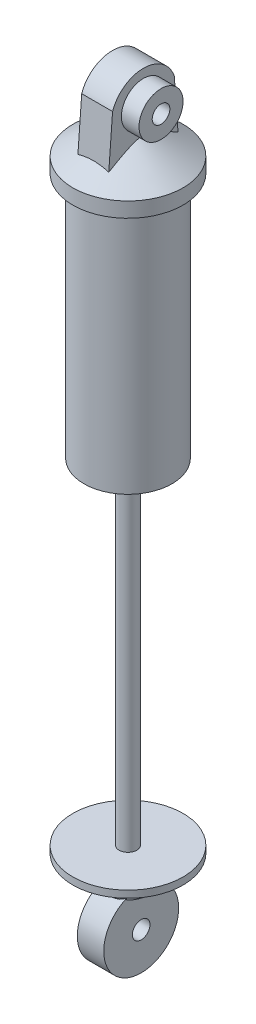
from build123d import *

# Parameters (mm, degrees)
SKETCH1_R          = 7.9375
EXTRUDE1_DEPTH     = 86.995
SKETCH4_R          = 1.27
EXTRUDE2_DEPTH     = 2.2225
SKETCH5_R          = 5.3975
SKETCH5_R_2        = 1.27
EXTRUDE3_DEPTH     = 1.905
SKETCH6_R          = 4.1275
EXTRUDE4_DEPTH     = 1.905
SKETCH7_R          = 2.8575
EXTRUDE5_DEPTH     = 1.905
SKETCH8_R          = 3.175
SKETCH8_R_2        = 1.27
EXTRUDE6_DEPTH     = 2.54
SKETCH10_R         = 7.9375
SKETCH10_R_2       = 6.35
CUT_EXTRUDE2_DEPTH = 38.1
SKETCH11_R         = 7.9375
SKETCH11_R_2       = 1.27
CUT_EXTRUDE3_DEPTH = 48.26


with BuildPart() as part:
    # Sketch1 → Extrude1 (new body)
    with BuildSketch(Plane(origin=(0, 0, 0), x_dir=(1, 0, 0), z_dir=(0, 1, 0))):
        with Locations(Location((0, 0, 0), (0, 0, 270))):
            Circle(SKETCH1_R)
    extrude(amount=-EXTRUDE1_DEPTH)

    # Loft1: read off the stored shape, not the designer's step
    # Loft1: loft between two sections, ruled curve by curve
    loft1_from = [
        Edge.make_bspline([(3.207196431, 0, 7.26070226), (17.72860095, 0, 0.846309398), (11.314208088, 0, -13.675095122), (-3.207196431, 0, -7.26070226), (-17.72860095, 0, -0.846309398), (-11.314208088, 0, 13.675095122), (3.207196431, 0, 7.26070226)], [0, 0, 0, 0, 0.5, 0.5, 0.5, 1, 1, 1, 1], 3, [1, 0.333333333, 0.333333333, 1, 0.333333333, 0.333333333, 1]),
    ]
    loft1_to = [
        Edge.make_bspline([(0.075387957, 3.937, 1.903507724), (3.882403406, 3.937, 1.75273181), (3.731627491, 3.937, -2.054283639), (-0.075387957, 3.937, -1.903507724), (-3.882403406, 3.937, -1.75273181), (-3.731627491, 3.937, 2.054283639), (0.075387957, 3.937, 1.903507724)], [0, 0, 0, 0, 0.5, 0.5, 0.5, 1, 1, 1, 1], 3, [1, 0.333333333, 0.333333333, 1, 0.333333333, 0.333333333, 1]),
    ]
    loft1 = Solid(Shell([*[Face.make_surface_from_curves(loft1_from[k], loft1_to[k]) for k in range(1)], Face(Wire(loft1_from)), Face(Wire(loft1_to))]))
    add(loft1)

    # Sketch4 → Extrude2 (add, symmetric)
    with BuildSketch(Plane(origin=(0, 0, 0), x_dir=(0, 0, -1), z_dir=(1, 0, 0))):
        with BuildLine():
            Line((4.965601833, 1.905), (4.445, 8.89))
            ThreePointArc((4.445, 8.89), (0, 12.065), (-4.445, 8.89))
            Line((-4.445, 8.89), (-4.965601949, 1.905))
            Line((-4.965601949, 1.905), (-5.107584298, 0))
            Line((-5.107584298, 0), (5.107584151, 0))
            Line((5.107584151, 0), (4.965601833, 1.905))
        make_face()
        with Locations((0, 7.62)):
            Circle(SKETCH4_R, mode=Mode.SUBTRACT)
    extrude(amount=EXTRUDE2_DEPTH, both=True)

    # Sketch6 → Extrude4 (add)
    with BuildSketch(Plane.XZ.offset(86.995)):
        with Locations(Location((0, 0, 0), (0, 0, 90))):
            Circle(SKETCH6_R)
    extrude(amount=EXTRUDE4_DEPTH)



with BuildPart() as body_2:
    # Sketch5 → Extrude3 (new, symmetric)
    with BuildSketch(Plane(origin=(0, 0, 0), x_dir=(0, 0, -1), z_dir=(1, 0, 0))):
        with Locations(Location((0, -95.5675, 0), (0, 0, 180))):
            Circle(SKETCH5_R)
        with Locations(Location((0, -95.5675, 0), (0, 0, 180))):
            Circle(SKETCH5_R_2, mode=Mode.SUBTRACT)
    extrude(amount=EXTRUDE3_DEPTH, both=True)


with BuildPart() as part_1:
    add(part.part)

    add(body_2.part)  # Extrude5 merges body 2
    # Sketch7 → Extrude5 (add)
    with BuildSketch(Plane.XZ.offset(88.9)):
        with Locations(Location((0, 0, 0), (0, 0, 117.266044451))):
            Circle(SKETCH7_R)
    extrude(amount=EXTRUDE5_DEPTH)

    # Sketch8 → Extrude6 (add)
    with BuildSketch(Plane(origin=(2.2225, 0, 0), x_dir=(0, 0, -1), z_dir=(1, 0, 0))):
        with Locations(Location((0, 7.62, 0), (0, 0, 180))):
            Circle(SKETCH8_R)
        with Locations((0, 7.62)):
            Circle(SKETCH8_R_2, mode=Mode.SUBTRACT)
    extrude(amount=EXTRUDE6_DEPTH)

    # Sketch10 → Cut-Extrude2 (cut)
    with BuildSketch(Plane(origin=(0, -2.159, 0), x_dir=(-1, 0, 0), z_dir=(0, 1, 0))):
        with Locations(Location((0, 0, 0), (0, 0, 90))):
            Circle(SKETCH10_R)
        with Locations(Location((0, 0, 0), (0, 0, 90))):
            Circle(SKETCH10_R_2, mode=Mode.SUBTRACT)
    extrude(amount=-CUT_EXTRUDE2_DEPTH, mode=Mode.SUBTRACT)

    # Sketch11 → Cut-Extrude3 (cut)
    with BuildSketch(Plane(origin=(0, -37.719, 0), x_dir=(-1, 0, 0), z_dir=(0, 1, 0))):
        with Locations(Location((0, 0, 0), (0, 0, 90))):
            Circle(SKETCH11_R)
        with Locations(Location((0, 0, 0), (0, 0, 90))):
            Circle(SKETCH11_R_2, mode=Mode.SUBTRACT)
    extrude(amount=-CUT_EXTRUDE3_DEPTH, mode=Mode.SUBTRACT)


solid = part_1.part
